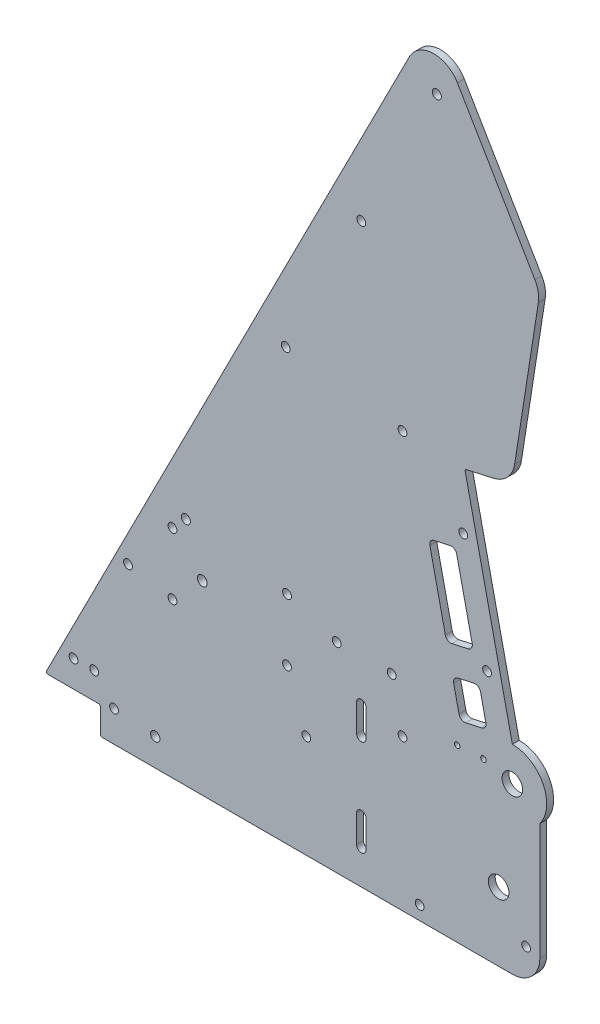
from build123d import *

# Parameters (mm, degrees)
BOSS_EXTRUDE1_DEPTH     = 3.175
SKETCH2_R               = 2.0955
SKETCH2_R_2             = 2.286
SKETCH2_R_3             = 2.032
SKETCH2_R_4             = 4.7625
CUT_EXTRUDE1_DEPTH      = 421.976111717
SKETCH7_R               = 2.159
CUT_EXTRUDE2_DEPTH      = 421.976111717
CUT_EXTRUDE3_REACH      = 422.976
SKETCH10_R              = 2.032
FILLET1_R               = 12.7
FILLET2_R               = 0.79375
SKETCH12_R              = 2.032
CUT_EXTRUDE5_DEPTH      = 410.593447353
SKETCH13_R              = 2.032
CUT_EXTRUDE6_DEPTH      = 410.593447353
CUT_EXTRUDE7_DEPTH      = 410.593447353
CUT_EXTRUDE7_DEPTH_BACK = 410.593447353
SKETCH14_R              = 1.27
SKETCH14_R_2            = 2.032
FILLET3_R               = 2.54


with BuildPart() as part:
    # Sketch1 → Boss-Extrude1 (new body)
    with BuildSketch(Plane.XY):
        with BuildLine():
            Line((228.6, -12.7), (228.6, 53.975))
            ThreePointArc((228.6, 53.975), (230.099031657, 70.599515829), (215.9, 79.375))
            Line((215.9, 79.375), (193.909735224, 178.566674323))
            Line((193.909735224, 178.566674323), (215.607913982, 183.377044743))
            Line((215.607913982, 183.377044743), (228.6, 266.7))
            Line((228.6, 266.7), (178.754725958, 351.413083686))
            Line((178.754725958, 351.413083686), (0, 0))
            Line((0, 0), (25.4, 0))
            Line((25.4, 0), (25.4, -12.7))
            Line((25.4, -12.7), (228.6, -12.7))
        make_face()
    extrude(amount=BOSS_EXTRUDE1_DEPTH)

    # Sketch2 → Cut-Extrude1 (cut, through all)
    with BuildSketch(Plane.XY.offset(3.175)):
        with Locations((64.943150167, 94.057839899)):
            Circle(SKETCH2_R)
        with Locations((180.975, 322.164313376)):
            Circle(SKETCH2_R)
        with Locations((72.544547852, 73.173171402)):
            Circle(SKETCH2_R_2)
        with Locations((193.207821773, 152.394364194)):
            Circle(SKETCH2_R_3)
        with Locations((215.9, 63.5)):
            Circle(SKETCH2_R_4)
        with Locations((173.0375, -6.35)):
            Circle(SKETCH2_R_3)
        with Locations((204.202954161, 102.798527032)):
            Circle(SKETCH2_R_3)
        with Locations((209.55, 19.05)):
            Circle(SKETCH2_R_4)
        with Locations((165.1, 179.3875)):
            Circle(SKETCH2_R_3)
        with Locations((111.724047852, 87.460671402)):
            Circle(SKETCH2_R_3)
        with Locations((111.724047852, 58.885671402)):
            Circle(SKETCH2_R_3)
        with Locations((58.765047852, 58.885671402)):
            Circle(SKETCH2_R_3)
        with Locations((58.765047852, 87.460671402)):
            Circle(SKETCH2_R_3)
    extrude(amount=-CUT_EXTRUDE1_DEPTH, mode=Mode.SUBTRACT)

    # Sketch7 → Cut-Extrude2 (cut, through all)
    with BuildSketch(Plane.XY.offset(3.175)):
        with Locations((50.8, 0)):
            Circle(SKETCH7_R)
        with BuildLine():
            Line((143.891, 3.175), (143.891, 15.875))
            ThreePointArc((143.891, 15.875), (146.05, 18.034), (148.209, 15.875))
            Line((148.209, 15.875), (148.209, 3.175))
            ThreePointArc((148.209, 3.175), (146.05, 1.016), (143.891, 3.175))
        make_face()
        with BuildLine():
            Line((143.891, 47.625), (143.891, 60.325))
            ThreePointArc((143.891, 60.325), (146.05, 62.484), (148.209, 60.325))
            Line((148.209, 60.325), (148.209, 47.625))
            ThreePointArc((148.209, 47.625), (146.05, 45.466), (143.891, 47.625))
        make_face()
    extrude(amount=-CUT_EXTRUDE2_DEPTH, mode=Mode.SUBTRACT)

    # Sketch10 → Cut-Extrude3 (cut, up to next)
    with BuildSketch(Plane.XY.offset(3.175), mode=Mode.PRIVATE) as cut_extrude3_sk1:
        with Locations((120.65, 34.925)):
            Circle(SKETCH10_R)
    cut_extrude3_tool1 = extrude(cut_extrude3_sk1.sketch, amount=-CUT_EXTRUDE3_REACH, mode=Mode.PRIVATE) & part.part
    # Sketch10 → Cut-Extrude3 (cut, up to next)
    with BuildSketch(Plane.XY.offset(3.175), mode=Mode.PRIVATE) as cut_extrude3_sk2:
        with Locations((165.1, 57.15)):
            Circle(SKETCH10_R)
    cut_extrude3_tool2 = extrude(cut_extrude3_sk2.sketch, amount=-CUT_EXTRUDE3_REACH, mode=Mode.PRIVATE) & part.part
    # Sketch10 → Cut-Extrude3 (cut, up to next)
    with BuildSketch(Plane.XY.offset(3.175), mode=Mode.PRIVATE) as cut_extrude3_sk3:
        with Locations((13.046467246, 12.334704411)):
            Circle(SKETCH10_R)
    cut_extrude3_tool3 = extrude(cut_extrude3_sk3.sketch, amount=-CUT_EXTRUDE3_REACH, mode=Mode.PRIVATE) & part.part
    # Sketch10 → Cut-Extrude3 (cut, up to next)
    with BuildSketch(Plane.XY.offset(3.175), mode=Mode.PRIVATE) as cut_extrude3_sk4:
        with Locations((22.571467246, 12.334704411)):
            Circle(SKETCH10_R)
    cut_extrude3_tool4 = extrude(cut_extrude3_sk4.sketch, amount=-CUT_EXTRUDE3_REACH, mode=Mode.PRIVATE) & part.part
    # Sketch10 → Cut-Extrude3 (cut, up to next)
    with BuildSketch(Plane.XY.offset(3.175), mode=Mode.PRIVATE) as cut_extrude3_sk5:
        with Locations((38.211447917, 62.639810909)):
            Circle(SKETCH10_R)
    cut_extrude3_tool5 = extrude(cut_extrude3_sk5.sketch, amount=-CUT_EXTRUDE3_REACH, mode=Mode.PRIVATE) & part.part
    add(cut_extrude3_tool1.solids().sort_by_distance((120.65, 34.925, 3.175))[0], mode=Mode.SUBTRACT)
    add(cut_extrude3_tool2.solids().sort_by_distance((165.1, 57.15, 3.175))[0], mode=Mode.SUBTRACT)
    add(cut_extrude3_tool3.solids().sort_by_distance((13.046467, 12.334704, 3.175))[0], mode=Mode.SUBTRACT)
    add(cut_extrude3_tool4.solids().sort_by_distance((22.571467, 12.334704, 3.175))[0], mode=Mode.SUBTRACT)
    add(cut_extrude3_tool5.solids().sort_by_distance((38.211448, 62.639811, 3.175))[0], mode=Mode.SUBTRACT)

    # Fillet1
    fillet1_edges = [part.edges().sort_by_distance(p)[0] for p in [
        (228.6, -12.7, 1.5875),
        (178.754725958, 351.413083686, 1.5875),
        (215.607913982, 183.377044743, 1.5875),
        (228.6, 266.7, 1.5875),
    ]]
    fillet(fillet1_edges, radius=FILLET1_R)

    # Fillet2
    fillet2_edges = [part.edges().sort_by_distance(p)[0] for p in [
        (25.4, -12.7, 1.5875),
        (25.4, 0, 1.5875),
        (193.909735224, 178.566674323, 1.5875),
        (0, 0, 1.5875),
    ]]
    fillet(fillet2_edges, radius=FILLET2_R)

    # Sketch12 → Cut-Extrude5 (cut, through all)
    with BuildSketch(Plane.XY.offset(3.175)):
        with Locations((31.75, 1.5875)):
            Circle(SKETCH12_R)
        with Locations((173.0375, -6.35)):
            Circle(SKETCH12_R)
        with Locations((222.25, 1.5875)):
            Circle(SKETCH12_R)
    extrude(amount=-CUT_EXTRUDE5_DEPTH, mode=Mode.SUBTRACT)

    # Sketch13 → Cut-Extrude6 (cut, through all)
    with BuildSketch(Plane.XY.offset(3.175)):
        with Locations((111.125, 186.055)):
            Circle(SKETCH13_R)
        with Locations((146.05, 254)):
            Circle(SKETCH13_R)
    extrude(amount=-CUT_EXTRUDE6_DEPTH, mode=Mode.SUBTRACT)

    # Sketch14 → Cut-Extrude7 (cut, two sides: drawn at the far end of the back side and taken through both)
    with BuildSketch(Plane.XY.offset(3.175).offset(-CUT_EXTRUDE7_DEPTH_BACK)):
        with Locations((190.426832263, 66.260948917)):
            Circle(SKETCH14_R)
        with Locations((202.533497378, 66.789537331)):
            Circle(SKETCH14_R)
        with Locations((160.111047852, 79.6925)):
            Circle(SKETCH14_R_2)
        with Locations((134.711047852, 79.6925)):
            Circle(SKETCH14_R_2)
        Polygon((177.223670315, 142.346588213), (189.622629605, 145.09537131), (197.868978896, 107.898493439), (185.470019606, 105.149710342), align=None)
        Polygon((188.218802703, 92.750751051), (200.617761993, 95.499534148), (204.191180019, 79.380887071), (191.792220729, 76.632103974), align=None)
    extrude(amount=CUT_EXTRUDE7_DEPTH + CUT_EXTRUDE7_DEPTH_BACK, mode=Mode.SUBTRACT)

    # Fillet3
    fillet3_edges = [part.edges().sort_by_distance(p)[0] for p in [
        (200.617761993, 95.499534148, 1.5875),
        (188.218802703, 92.750751051, 1.5875),
        (191.792220729, 76.632103974, 1.5875),
        (204.191180019, 79.380887071, 1.5875),
        (197.868978896, 107.898493439, 1.5875),
        (185.470019606, 105.149710342, 1.5875),
        (177.223670315, 142.346588213, 1.5875),
        (189.622629605, 145.09537131, 1.5875),
    ]]
    fillet(fillet3_edges, radius=FILLET3_R)


solid = part.part
